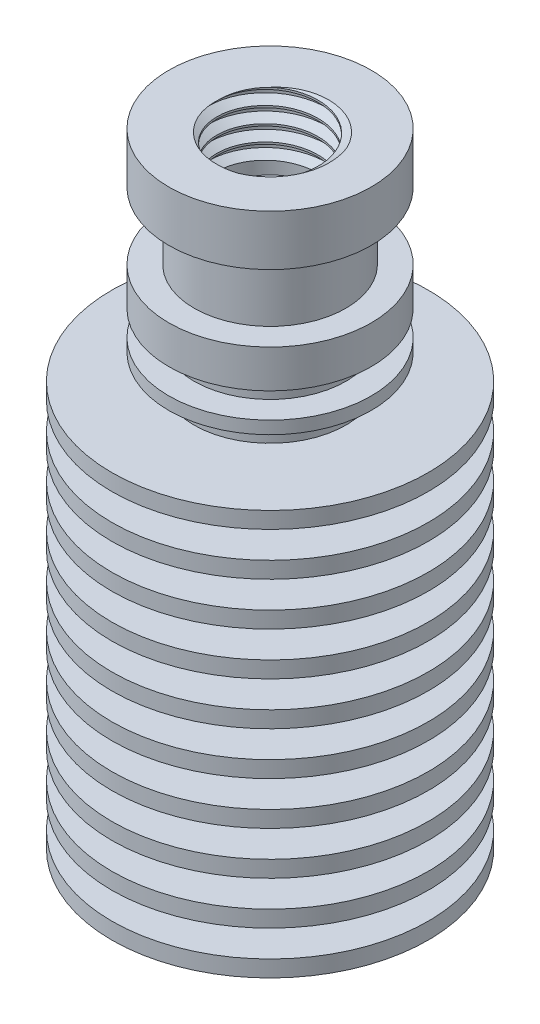
from build123d import *

# Parameters (mm, degrees)
THREAD1_PITCH = 1
THREAD2_PITCH = 1.25


with BuildPart() as part:
    # Sketch1 → Revolve1 (revolve)
    with BuildSketch(Plane.XY, mode=Mode.PRIVATE) as revolve1_sk:
        Polygon((6, -9.3), (8, -9.3), (8, -12.3), (6, -12.3), (6, -14.3), (8, -14.3), (8, -15.3), (6, -15.3), (6, -17.3), (12.5, -17.3), (12.5, -18.6), (7.5, -18.6), (7.5, -20.711111111), (12.5, -20.711111111), (12.5, -22.011111111), (7.5, -22.011111111), (7.5, -24.122222222), (12.5, -24.122222222), (12.5, -25.422222222), (7.5, -25.422222222), (7.5, -27.533333333), (12.5, -27.533333333), (12.5, -28.833333333), (7.5, -28.833333333), (7.5, -30.944444444), (12.5, -30.944444444), (12.5, -32.244444444), (7.5, -32.244444444), (7.5, -34.355555556), (12.5, -34.355555556), (12.5, -35.655555556), (7.5, -35.655555556), (7.5, -37.766666667), (12.5, -37.766666667), (12.5, -39.066666667), (7.5, -39.066666667), (7.5, -41.177777778), (12.5, -41.177777778), (12.5, -42.477777778), (7.5, -42.477777778), (7.5, -44.588888889), (12.5, -44.588888889), (12.5, -45.888888889), (7.5, -45.888888889), (7.5, -48), (12.5, -48), (12.5, -49.3), (3, -49.3), (3, -25.3), (1, -25.3), (1, -8), (4, -6), (4, 0), (8, 0), (8, -4), (6, -4), align=None)
    revolve(revolve1_sk.sketch.rotate(Axis((0, 5.388435245, 0), (0, -1, 0)), 90), axis=Axis((0, 5.388435245, 0), (0, -1, 0)))

    # Thread1: the profile of Thread Profile1 profile screwed along a right-hand helix of 25 turns, 8 arcs to a turn; built about Z, then put on its axis
    thread1_z = Axis((0, 0, 0), (0, 0, 1))
    thread1_corners = [(2.9997, 0, 0.875173208), (2.9997, 0, -0.000173205), (3.54126588, 0, 0.312500002), (3.54126588, 0, 0.562500002)]
    with BuildLine(mode=Mode.PRIVATE) as thread1_profile:
        Line(thread1_corners[0], thread1_corners[1])
        Line(thread1_corners[1], thread1_corners[2])
        Line(thread1_corners[2], thread1_corners[3])
        Line(thread1_corners[3], thread1_corners[0])
    thread1_cap = Face(thread1_profile.wire())
    thread1_turn_angles = [0, 22.5, 45, 67.5, 90, 112.5, 135, 157.5, 180, 202.5, 225, 247.5, 270, 292.5, 315, 337.5, 360]
    thread1_turn_weights = [1, 0.9238795325112867, 1, 0.9238795325112867, 1, 0.9238795325112867, 1, 0.9238795325112867, 1, 0.9238795325112867, 1, 0.9238795325112867, 1, 0.9238795325112867, 1, 0.9238795325112867, 1]
    thread1_turn_rails = [Edge.make_bspline([Vector(p[0], p[1], 0).rotate(thread1_z, thread1_turn_angles[k]) / thread1_turn_weights[k] + Vector(0, 0, p[2] + THREAD1_PITCH * thread1_turn_angles[k] / 360) for k in range(17)], [0, 0, 0, 1, 1, 2, 2, 3, 3, 4, 4, 5, 5, 6, 6, 7, 7, 8, 8, 8], 2, thread1_turn_weights) for p in thread1_corners]
    thread1_turn_sides = [Face.make_surface_from_curves(thread1_turn_rails[p[0]], thread1_turn_rails[p[1]]) for p in [(0, 1), (1, 2), (2, 3), (3, 0)]]
    thread1 = Plane(origin=(0, -50.3, 0), x_dir=(1, 0, 0), z_dir=(0, 1, 0)) * Solid(Shell([*[p.moved(Location((0, 0, THREAD1_PITCH * i))) for i in range(25) for p in thread1_turn_sides], thread1_cap, thread1_cap.rotate(thread1_z, 9000).moved(Location((0, 0, THREAD1_PITCH * 9000 / 360)))]))
    add(thread1, mode=Mode.SUBTRACT)

    # Thread2: the profile of Thread Profile3 profile screwed along a right-hand helix of 4.8 turns, 8 arcs to a turn; built about Z, then put on its axis
    thread2_z = Axis((0, 0, 0), (0, 0, 1))
    thread2_corners = [(3.9997, 0, 1.093923209), (3.9997, 0, -0.000173205), (4.67658235, 0, 0.390625002), (4.67658235, 0, 0.703125002)]
    with BuildLine(mode=Mode.PRIVATE) as thread2_profile:
        Line(thread2_corners[0], thread2_corners[1])
        Line(thread2_corners[1], thread2_corners[2])
        Line(thread2_corners[2], thread2_corners[3])
        Line(thread2_corners[3], thread2_corners[0])
    thread2_cap = Face(thread2_profile.wire())
    thread2_turn_angles = [0, 22.5, 45, 67.5, 90, 112.5, 135, 157.5, 180, 202.5, 225, 247.5, 270, 292.5, 315, 337.5, 360]
    thread2_turn_weights = [1, 0.9238795325112867, 1, 0.9238795325112867, 1, 0.9238795325112867, 1, 0.9238795325112867, 1, 0.9238795325112867, 1, 0.9238795325112867, 1, 0.9238795325112867, 1, 0.9238795325112867, 1]
    thread2_turn_rails = [Edge.make_bspline([Vector(p[0], p[1], 0).rotate(thread2_z, thread2_turn_angles[k]) / thread2_turn_weights[k] + Vector(0, 0, p[2] + THREAD2_PITCH * thread2_turn_angles[k] / 360) for k in range(17)], [0, 0, 0, 1, 1, 2, 2, 3, 3, 4, 4, 5, 5, 6, 6, 7, 7, 8, 8, 8], 2, thread2_turn_weights) for p in thread2_corners]
    thread2_turn_sides = [Face.make_surface_from_curves(thread2_turn_rails[p[0]], thread2_turn_rails[p[1]]) for p in [(0, 1), (1, 2), (2, 3), (3, 0)]]
    thread2_last_angles = [1440, 1462.5, 1485, 1507.5, 1530, 1552.5, 1575, 1597.5, 1620, 1642.5, 1665, 1687.5, 1710, 1719, 1728]
    thread2_last_weights = [1, 0.9238795325112867, 1, 0.9238795325112867, 1, 0.9238795325112867, 1, 0.9238795325112867, 1, 0.9238795325112867, 1, 0.9238795325112867, 1, 0.9876883405951378, 1]
    thread2_last_rails = [Edge.make_bspline([Vector(p[0], p[1], 0).rotate(thread2_z, thread2_last_angles[k]) / thread2_last_weights[k] + Vector(0, 0, p[2] + THREAD2_PITCH * thread2_last_angles[k] / 360) for k in range(15)], [0, 0, 0, 1, 1, 2, 2, 3, 3, 4, 4, 5, 5, 6, 6, 7, 7, 7], 2, thread2_last_weights) for p in thread2_corners]
    thread2_last_sides = [Face.make_surface_from_curves(thread2_last_rails[p[0]], thread2_last_rails[p[1]]) for p in [(0, 1), (1, 2), (2, 3), (3, 0)]]
    thread2 = Plane(origin=(0, 1.25, 0), x_dir=(-1, 0, 0), z_dir=(0, -1, 0)) * Solid(Shell([*[p.moved(Location((0, 0, THREAD2_PITCH * i))) for i in range(4) for p in thread2_turn_sides], *thread2_last_sides, thread2_cap, thread2_cap.rotate(thread2_z, 1728).moved(Location((0, 0, THREAD2_PITCH * 1728 / 360)))]))
    add(thread2, mode=Mode.SUBTRACT)


solid = part.part
